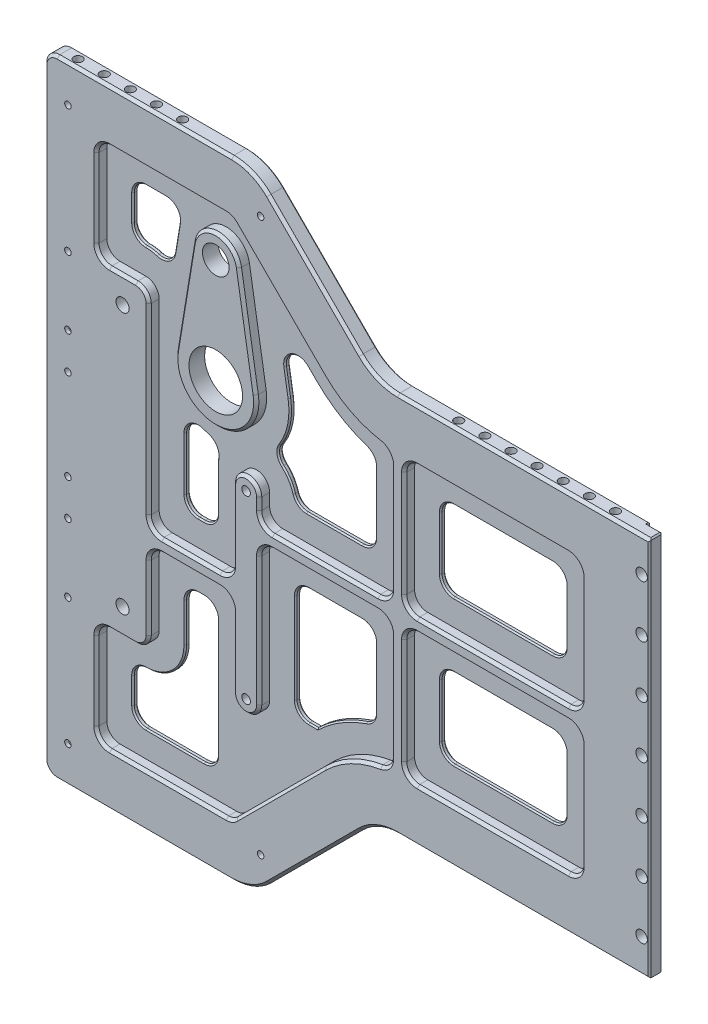
from build123d import *

# Parameters (mm, degrees)
EXTRUDE_1_DEPTH             = 5.999999995
CUT_EXTRUDE_1_DEPTH         = 306.838828368
CUT_EXTRUDE_1_DEPTH_BACK    = 306.838828368
SKETCH_3_W                  = 6
SKETCH_3_H                  = 0.999999998
CHAMFER_1_SIZE              = 1
M22X1_5_1_D                 = 20.5
HOLE_WIZARD_M12_1_D         = 10.2
HOLE_WIZARD_M4_1_D          = 3.3
CUT_EXTRUDE_2_DEPTH         = 4
FILLET_1_R                  = 5
SKETCH_14_W                 = 20
SKETCH_14_H                 = 120
EXTRUDE_2_DEPTH             = 4
FILLET_2_R                  = 5
SKETCH_15_W                 = 123.39
SKETCH_15_H                 = 5
SKETCH_15_W_2               = 32.285860782
EXTRUDE_3_DEPTH             = 4
FILLET_3_R                  = 5
EXTRUDE_START               = -5
EXTRUDE_4_DEPTH             = 5
FILLET_4_R                  = 5
CHAMFER_2_SIZE              = 1
CHAMFER_3_SIZE              = 1
SKETCH_17_W                 = 47.891589535
SKETCH_17_H                 = 30.5
CUT_EXTRUDE_3_DEPTH         = 4
FILLET_5_R                  = 5
CHAMFER_4_SIZE              = 0.5
HOLE_WIZARD_M6_1_D          = 5
HOLE_WIZARD_M3_1_D          = 2.5
HOLE_WIZARD_M3_1_DEPTH      = 7.5
HOLE_WIZARD_M3_1_TIP        = 0.751075774
HOLE_WIZARD_M4_2_AT_2_COUNT = 2
HOLE_WIZARD_M4_2_AT_2_PITCH = 10
HOLE_WIZARD_M4_2_AT_3_COUNT = 2
HOLE_WIZARD_M4_2_AT_3_PITCH = 20
HOLE_WIZARD_M4_2_AT_4_COUNT = 2
HOLE_WIZARD_M4_2_AT_4_PITCH = 30
HOLE_WIZARD_M4_2_AT_5_COUNT = 2
HOLE_WIZARD_M4_2_AT_5_PITCH = 40
HOLE_WIZARD_M4_2_AT_6_COUNT = 2
HOLE_WIZARD_M4_2_AT_6_PITCH = 50
HOLE_WIZARD_M4_2_AT_7_COUNT = 2
HOLE_WIZARD_M4_2_AT_7_PITCH = 60
HOLE_WIZARD_M4_3_AT_2_COUNT = 2
HOLE_WIZARD_M4_3_AT_2_PITCH = 10
HOLE_WIZARD_M4_3_AT_3_COUNT = 2
HOLE_WIZARD_M4_3_AT_3_PITCH = 20
HOLE_WIZARD_M4_3_AT_4_COUNT = 2
HOLE_WIZARD_M4_3_AT_4_PITCH = 30
HOLE_WIZARD_M4_3_AT_5_COUNT = 2
HOLE_WIZARD_M4_3_AT_5_PITCH = 40
HOLE_WIZARD_M4_4_AT_2_COUNT = 2
HOLE_WIZARD_M4_4_AT_2_PITCH = 7.5
CUT_EXTRUDE_4_DEPTH         = 338.473538273
CUT_EXTRUDE_4_DEPTH_BACK    = 338.473538273
SKETCH_32_R                 = 2.2
PATTERN_LINEAR_1_COUNT      = 7
PATTERN_LINEAR_1_PITCH      = 10
CHAMFER_5_SIZE              = 0.5


with BuildPart() as part:
    # 草图2 → 凸台-拉伸1 (new body)
    with BuildSketch(Plane.XY):
        with BuildLine():
            Line((-5.5, 47), (-5.5, 193))
            Line((-5.5, 193), (-101.891589535, 193))
            ThreePointArc((-101.891589535, 193), (-109.545258182, 194.52240935), (-116.033725159, 198.857864377))
            Line((-116.033725159, 198.857864377), (-151.317996406, 234.142135624))
            ThreePointArc((-151.317996406, 234.142135624), (-157.806463382, 238.477590651), (-165.46013203, 240))
            Line((-165.46013203, 240), (-232.175860782, 240))
            ThreePointArc((-232.175860782, 240), (-235.711394688, 238.535533906), (-237.175860782, 235))
            Line((-237.175860782, 235), (-237.175860782, 5))
            ThreePointArc((-237.175860782, 5), (-235.711394688, 1.464466094), (-232.175860782, 0))
            Line((-232.175860782, 0), (-165.46013203, 0))
            ThreePointArc((-165.46013203, 0), (-157.806463382, 1.52240935), (-151.317996406, 5.857864377))
            Line((-151.317996406, 5.857864377), (-116.033725158, 41.142135624))
            ThreePointArc((-116.033725158, 41.142135624), (-109.545258182, 45.477590651), (-101.891589535, 47))
            Line((-101.891589535, 47), (-5.5, 47))
        make_face()
    extrude(amount=-EXTRUDE_1_DEPTH)

    # 草图3 → 切除-拉伸1 (cut, two sides: drawn at the far end of the back side and taken through both)
    with BuildSketch(Plane.XZ.offset(-47).offset(-CUT_EXTRUDE_1_DEPTH_BACK)):
        with Locations((-8.5, -5.499999999)):
            Rectangle(SKETCH_3_W, SKETCH_3_H)
    extrude(amount=CUT_EXTRUDE_1_DEPTH + CUT_EXTRUDE_1_DEPTH_BACK, mode=Mode.SUBTRACT)

    # 倒角1
    chamfer_1_edges = [part.edges().sort_by_distance(p)[0] for p in [
        (-109.545258182, 45.477590651, 0),
        (-133.675860782, 23.5, 0),
        (-157.806463382, 1.52240935, 0),
        (-198.817996406, 0, 0),
        (-235.711394688, 1.464466094, 0),
        (-237.175860782, 120, 0),
        (-235.711394688, 238.535533906, 0),
        (-198.817996406, 240, 0),
        (-157.806463382, 238.477590651, 0),
        (-133.675860782, 216.5, 0),
        (-109.545258182, 194.52240935, 0),
        (-53.695794768, 193, 0),
        (-53.695794767, 47, 0),
    ]]
    chamfer(chamfer_1_edges, length=CHAMFER_1_SIZE)

    # M22x1.5 螺纹孔1 (through all)
    with Locations(Plane.XY):
        with Locations((-171.5, 162.75)):
            Hole(M22X1_5_1_D / 2)

    # M12 螺纹孔1 (through all)
    with Locations(Plane.XY):
        with Locations((-171.5, 202.75)):
            Hole(HOLE_WIZARD_M12_1_D / 2)

    # M4 螺纹孔1 (through all)
    with Locations(Plane.XY):
        with Locations((-159.89, 63), (-159.89, 132)):
            Hole(HOLE_WIZARD_M4_1_D / 2)

    # 草图13 → 切除-拉伸2 (cut)
    with BuildSketch(Plane.XY):
        with BuildLine():
            Line((-31.5, 173), (-101.891589535, 173))
            ThreePointArc((-101.891589535, 173), (-117.198926829, 176.0448187), (-130.175860782, 184.715728753))
            Line((-130.175860782, 184.715728753), (-165.46013203, 220))
            Line((-165.46013203, 220), (-217.175860782, 220))
            Line((-217.175860782, 220), (-217.175860782, 20))
            Line((-217.175860782, 20), (-165.46013203, 20))
            Line((-165.46013203, 20), (-130.175860782, 55.284271248))
            ThreePointArc((-130.175860782, 55.284271248), (-117.198926829, 63.955181301), (-101.891589535, 67))
            Line((-101.891589535, 67), (-31.5, 67))
            Line((-31.5, 67), (-31.5, 173))
        make_face()
        with BuildLine():
            Line((-180.380376893, 204.2125), (-186.793982426, 165.26875))
            ThreePointArc((-186.793982426, 165.26875), (-171.5, 147.25), (-156.206017575, 165.26875))
            Line((-156.206017575, 165.26875), (-162.619623108, 204.2125))
            ThreePointArc((-162.619623108, 204.2125), (-171.5, 211.75), (-180.380376893, 204.2125))
        make_face(mode=Mode.SUBTRACT)
        with BuildLine():
            Line((-164.89, 132), (-164.89, 63))
            ThreePointArc((-164.89, 63), (-159.89, 58), (-154.89, 63))
            Line((-154.89, 63), (-154.89, 132))
            ThreePointArc((-154.89, 132), (-159.89, 137), (-164.89, 132))
        make_face(mode=Mode.SUBTRACT)
    extrude(amount=-CUT_EXTRUDE_2_DEPTH, mode=Mode.SUBTRACT)

    # 圆角1
    fillet_1_edges = [part.edges().sort_by_distance(p)[0] for p in [
        (-31.5, 173, -2),
        (-31.5, 67, -2),
        (-165.46013203, 20, -2),
        (-217.175860782, 20, -2),
        (-217.175860782, 220, -2),
        (-165.46013203, 220, -2),
    ]]
    fillet(fillet_1_edges, radius=FILLET_1_R)

    # 草图14 → 凸台-拉伸2 (add)
    with BuildSketch(Plane.XY.offset(-4)):
        with Locations((-207.175860782, 120)):
            Rectangle(SKETCH_14_W, SKETCH_14_H)
    extrude(amount=EXTRUDE_2_DEPTH)

    # 圆角2
    fillet_2_edges = [part.edges().sort_by_distance(p)[0] for p in [
        (-197.175860782, 60, -2),
        (-197.175860782, 180, -2),
        (-217.175860782, 180, -2),
        (-217.175860782, 60, -2),
    ]]
    fillet(fillet_2_edges, radius=FILLET_2_R)

    # 草图15 → 凸台-拉伸3 (add)
    with BuildSketch(Plane.XY):
        with Locations((-93.195, 120)):
            Rectangle(SKETCH_15_W, SKETCH_15_H)
        with Locations((-181.032930391, 97.5)):
            Rectangle(SKETCH_15_W_2, SKETCH_15_H)
    extrude(amount=-EXTRUDE_3_DEPTH)

    # 圆角3
    fillet_3_edges = [part.edges().sort_by_distance(p)[0] for p in [
        (-31.5, 122.5, -2),
        (-31.5, 117.5, -2),
        (-154.89, 117.5, -2),
        (-154.89, 122.5, -2),
        (-164.89, 100, -2),
        (-164.89, 95, -2),
        (-197.175860782, 95, -2),
        (-197.175860782, 100, -2),
    ]]
    fillet(fillet_3_edges, radius=FILLET_3_R)

    # 凸台-拉伸4: read off the stored shape, not the designer's step
    # 凸台-拉伸4 outline → 凸台-拉伸4 (add)
    with BuildSketch(Plane.XY.offset(EXTRUDE_START)):
        with BuildLine():
            ThreePointArc((-101.891589535, 173), (-103.142200932, 173.019555141), (-104.391589535, 173.078201443))
            Line((-104.391589535, 173.078201443), (-104.391589535, 122.5))
            Line((-104.391589535, 122.5), (-99.391589535, 122.5))
            Line((-99.391589535, 122.5), (-99.391589535, 173))
            Line((-99.391589535, 173), (-101.891589535, 173))
        make_face()
        with BuildLine():
            Line((-99.391589535, 117.5), (-104.391589535, 117.5))
            Line((-104.391589535, 117.5), (-104.391589535, 66.921798557))
            ThreePointArc((-104.391589535, 66.921798557), (-103.142200932, 66.980444859), (-101.891589535, 67))
            Line((-101.891589535, 67), (-99.391589535, 67))
            Line((-99.391589535, 67), (-99.391589535, 117.5))
        make_face()
    extrude(amount=EXTRUDE_4_DEPTH)

    # 圆角4
    fillet_4_edges = [part.edges().sort_by_distance(p)[0] for p in [
        (-99.391589535, 122.5, -2),
        (-104.391589535, 122.5, -2),
        (-104.391589535, 173.078201443, -2),
        (-99.391589535, 173, -2),
        (-104.391589535, 117.5, -2),
        (-99.391589535, 117.5, -2),
        (-99.391589535, 67, -2),
        (-104.391589535, 66.921798557, -2),
    ]]
    fillet(fillet_4_edges, radius=FILLET_4_R)

    # 倒角2
    chamfer_2_edges = [part.edges().sort_by_distance(p)[0] for p in [
        (-147.085763359, 201.62563133, 0),
        (-120.235731737, 62.545638929, 0),
        (-159.89, 137, 0),
        (-154.89, 87.75, 0),
        (-159.89, 58, 0),
        (-164.89, 118.5, 0),
        (-65.445794768, 173, 0),
        (-31.5, 92.25, 0),
        (-147.085763359, 38.374368671, 0),
        (-189.853530312, 20, 0),
        (-217.175860782, 200, 0),
        (-189.853530312, 220, 0),
        (-32.964466094, 171.535533906, 0),
        (-32.964466094, 68.464466094, 0),
        (-165.61778268, 20.380602338, 0),
        (-215.711394688, 218.535533906, 0),
        (-165.61778268, 219.619397663, 0),
        (-215.711394688, 21.464466094, 0),
        (-197.175860782, 77.5, 0),
        (-207.175860782, 60, 0),
        (-217.175860782, 40, 0),
        (-207.175860782, 180, 0),
        (-198.640326876, 178.535533906, 0),
        (-198.640326876, 61.464466094, 0),
        (-215.711394688, 181.464466094, 0),
        (-215.711394688, 58.535533906, 0),
        (-129.640794768, 117.5, 0),
        (-181.032930391, 95, 0),
        (-164.89, 76.5, 0),
        (-181.032930391, 100, 0),
        (-197.175860782, 140, 0),
        (-65.445794768, 122.5, 0),
        (-154.89, 129.75, 0),
        (-31.5, 147.75, 0),
        (-153.425533906, 116.035533906, 0),
        (-166.354466094, 93.535533906, 0),
        (-195.711394688, 93.535533906, 0),
        (-32.964466094, 116.035533906, 0),
        (-195.711394688, 101.464466094, 0),
        (-153.425533906, 123.964466095, 0),
        (-166.354466094, 101.464466094, 0),
        (-32.964466094, 123.964466095, 0),
        (-104.391589535, 148.064700814, 0),
        (-129.640794768, 122.5, 0),
        (-104.391589535, 91.935299187, 0),
        (-99.391589535, 147.75, 0),
        (-99.391589535, 92.25, 0),
        (-65.445794768, 117.5, 0),
        (-120.235731737, 177.454361072, 0),
        (-65.445794768, 67, 0),
        (-105.856055629, 123.964466095, 0),
        (-105.856055629, 116.035533906, 0),
        (-97.927123441, 123.964466095, 0),
        (-97.927123441, 116.035533906, 0),
        (-97.927123441, 171.535533906, 0),
        (-105.572776456, 171.856887749, 0),
        (-97.927123441, 68.464466094, 0),
        (-105.572776456, 68.143112252, 0),
    ]]
    chamfer(chamfer_2_edges, length=CHAMFER_2_SIZE)

    # 倒角3
    chamfer_3_edges = [part.edges().sort_by_distance(p)[0] for p in [
        (-171.5, 211.75, 0),
        (-159.412820341, 184.740625, 0),
        (-171.5, 147.25, 0),
        (-183.587179659, 184.740625, 0),
    ]]
    chamfer(chamfer_3_edges, length=CHAMFER_3_SIZE)

    # 草图17 → 切除-拉伸3 (cut)
    with BuildSketch(Plane.XY.offset(-4)):
        with BuildLine():
            ThreePointArc((-189.260753785, 205.675), (-188.754109212, 207.877934798), (-187.975360391, 210))
            Line((-187.975360391, 210), (-207.175860782, 210))
            Line((-207.175860782, 210), (-207.175860782, 190))
            Line((-207.175860782, 190), (-202.175860782, 190))
            ThreePointArc((-202.175860782, 190), (-196.98409978, 189.072868141), (-192.434131716, 186.40608236))
            Line((-192.434131716, 186.40608236), (-189.260753785, 205.675))
        make_face()
        with BuildLine():
            ThreePointArc((-174.89, 132), (-174.535447054, 135.242048826), (-173.488549255, 138.330833923))
            ThreePointArc((-173.488549255, 138.330833923), (-180.763982021, 140.068980685), (-187.175860782, 143.921367847))
            Line((-187.175860782, 143.921367847), (-187.175860782, 110))
            Line((-187.175860782, 110), (-174.89, 110))
            Line((-174.89, 110), (-174.89, 132))
        make_face()
        with BuildLine():
            ThreePointArc((-114.391589535, 164.587708173), (-126.693895335, 169.585191156), (-137.246928594, 177.644660941))
            Line((-137.246928594, 177.644660941), (-151.464423298, 191.862155645))
            Line((-151.464423298, 191.862155645), (-147.325640682, 166.73125))
            ThreePointArc((-147.325640682, 166.73125), (-148.109839565, 155.459568271), (-153.868837287, 145.738471515))
            ThreePointArc((-153.868837287, 145.738471515), (-147.47231071, 140.414332575), (-144.89833565, 132.5))
            Line((-144.89833565, 132.5), (-114.391589535, 132.5))
            Line((-114.391589535, 132.5), (-114.391589535, 164.587708173))
        make_face()
        with BuildLine():
            Line((-144.89, 107.5), (-144.89, 63))
            Line((-144.89, 63), (-136.59029268, 63))
            ThreePointArc((-136.590292681, 63), (-126.293344426, 70.641200239), (-114.391589535, 75.412291828))
            Line((-114.391589535, 75.412291828), (-114.391589535, 107.5))
            Line((-114.391589535, 107.5), (-144.89, 107.5))
        make_face()
        with BuildLine():
            Line((-202.175860782, 50), (-207.175860782, 50))
            Line((-207.175860782, 50), (-207.175860782, 30))
            Line((-207.175860782, 30), (-174.89, 30))
            Line((-174.89, 30), (-174.89, 63))
            Line((-174.89, 63), (-174.89, 85))
            Line((-174.89, 85), (-187.175860782, 85))
            Line((-187.175860782, 85), (-187.175860782, 65))
            ThreePointArc((-187.175860782, 65), (-191.569259064, 54.393398282), (-202.175860782, 50))
        make_face()
        with Locations((-65.445794768, 92.25)):
            Rectangle(SKETCH_17_W, SKETCH_17_H)
        with Locations((-65.445794768, 147.75)):
            Rectangle(SKETCH_17_W, SKETCH_17_H)
    extrude(amount=-CUT_EXTRUDE_3_DEPTH, mode=Mode.SUBTRACT)

    # 圆角5
    fillet_5_edges = [part.edges().sort_by_distance(p)[0] for p in [
        (-187.175860782, 85, -4.999999997),
        (-174.89, 85, -4.999999997),
        (-153.868837287, 145.738471515, -4.999999997),
        (-173.488549255, 138.330833923, -4.999999997),
        (-114.391589535, 132.5, -4.999999997),
        (-144.89833565, 132.5, -4.999999997),
        (-192.434131716, 186.40608236, -4.999999997),
        (-174.89, 110, -4.999999997),
        (-187.175860782, 110, -4.999999997),
        (-187.175860782, 143.921367847, -4.999999997),
        (-144.89, 63, -4.999999997),
        (-144.89, 107.5, -4.999999997),
        (-114.391589535, 107.5, -4.999999997),
        (-89.391589535, 107.5, -4.999999997),
        (-89.391589535, 132.5, -4.999999997),
        (-41.5, 132.5, -4.999999997),
        (-41.5, 107.5, -4.999999997),
        (-89.391589535, 163, -4.999999997),
        (-41.5, 163, -4.999999997),
        (-41.5, 77, -4.999999997),
        (-89.391589535, 77, -4.999999997),
        (-114.391589535, 75.412291828, -4.999999997),
        (-114.391589535, 164.587708173, -4.999999997),
        (-151.464423298, 191.862155645, -4.999999997),
        (-187.975360391, 210, -4.999999997),
        (-207.175860782, 210, -4.999999997),
        (-207.175860782, 190, -4.999999997),
        (-174.89, 30, -4.999999997),
        (-207.175860782, 30, -4.999999997),
        (-207.175860782, 50, -4.999999997),
    ]]
    fillet(fillet_5_edges, radius=FILLET_5_R - 0.0001)  # a hair under: the kernel refuses the full size

    # 倒角4
    chamfer_4_edges = [part.edges().sort_by_distance(p)[0] for p in [
        (-187.175860782, 72.50005, -4),
        (-187.175860782, 72.50005, -5.999999995),
        (-181.032930391, 85, -4),
        (-181.032930391, 85, -5.999999995),
        (-174.89, 57.5, -5.999999995),
        (-174.89, 57.5, -4),
        (-147.189792596, 139.981524408, -5.999999995),
        (-147.189792596, 139.981524408, -4),
        (-147.494160374, 157.854117664, -5.999999995),
        (-147.494160374, 157.854117664, -4),
        (-114.391589535, 149.179168942, -4),
        (-114.391589535, 149.179168942, -5.999999995),
        (-130.02634021, 132.5, -4),
        (-130.02634021, 132.5, -5.999999995),
        (-190.403511183, 198.736116995, -5.999999995),
        (-190.403511183, 198.736116995, -4),
        (-199.922359725, 189.829758359, -5.999999995),
        (-199.922359725, 189.829758359, -4),
        (-174.89, 123.49995, -4),
        (-174.89, 123.49995, -5.999999995),
        (-181.032930391, 110, -4),
        (-181.032930391, 110, -5.999999995),
        (-187.175860782, 125.124786715, -4),
        (-187.175860782, 125.124786715, -5.999999995),
        (-179.363393998, 139.546184907, -5.999999995),
        (-179.363393998, 139.546184907, -4),
        (-174.86230757, 132.911046668, -5.999999995),
        (-174.86230757, 132.911046668, -4),
        (-138.24019634, 63, -4),
        (-138.24019634, 63, -5.999999995),
        (-144.89, 85.25, -4),
        (-144.89, 85.25, -5.999999995),
        (-129.640794768, 107.5, -4),
        (-129.640794768, 107.5, -5.999999995),
        (-114.391589535, 90.820831059, -4),
        (-114.391589535, 90.820831059, -5.999999995),
        (-89.391589535, 92.25, -4),
        (-89.391589535, 92.25, -5.999999995),
        (-65.445794768, 107.5, -4),
        (-65.445794768, 107.5, -5.999999995),
        (-65.445794768, 132.5, -4),
        (-65.445794768, 132.5, -5.999999995),
        (-89.391589535, 147.75, -4),
        (-89.391589535, 147.75, -5.999999995),
        (-41.5, 147.75, -4),
        (-41.5, 147.75, -5.999999995),
        (-41.5, 92.25, -4),
        (-41.5, 92.25, -5.999999995),
        (-65.445794768, 163, -4),
        (-65.445794768, 163, -5.999999995),
        (-65.445794768, 77, -4),
        (-65.445794768, 77, -5.999999995),
        (-127.829673943, 69.745944571, -5.999999995),
        (-127.829673943, 69.745944571, -4),
        (-198.307557146, 210, -4),
        (-198.307557146, 210, -5.999999995),
        (-207.175860782, 200, -4),
        (-207.175860782, 200, -5.999999995),
        (-191.032930391, 30, -4),
        (-191.032930391, 30, -5.999999995),
        (-207.175860782, 40, -4),
        (-207.175860782, 40, -5.999999995),
        (-185.711423977, 83.535563195, -4),
        (-185.711423977, 83.535563195, -5.999999995),
        (-176.354436805, 83.535563195, -4),
        (-176.354436805, 83.535563195, -5.999999995),
        (-151.545831458, 146.247727068, -4),
        (-151.545831458, 146.247727068, -5.999999995),
        (-115.85602634, 133.964436805, -4),
        (-115.85602634, 133.964436805, -5.999999995),
        (-143.671536847, 133.507805663, -4),
        (-143.671536847, 133.507805663, -5.999999995),
        (-193.608674211, 189.842375946, -4),
        (-193.608674211, 189.842375946, -5.999999995),
        (-176.354436805, 111.464436805, -4),
        (-176.354436805, 111.464436805, -5.999999995),
        (-185.711423977, 111.464436805, -4),
        (-185.711423977, 111.464436805, -5.999999995),
        (-185.000133833, 139.375572919, -4),
        (-185.000133833, 139.375572919, -5.999999995),
        (-175.568459377, 137.177720234, -4),
        (-175.568459377, 137.177720234, -5.999999995),
        (-143.425563196, 64.464436805, -4),
        (-143.425563196, 64.464436805, -5.999999995),
        (-143.425563196, 106.035563196, -4),
        (-143.425563196, 106.035563196, -5.999999995),
        (-115.85602634, 106.035563196, -4),
        (-115.85602634, 106.035563196, -5.999999995),
        (-87.92715273, 106.035563196, -4),
        (-87.92715273, 106.035563196, -5.999999995),
        (-87.92715273, 133.964436805, -4),
        (-87.92715273, 133.964436805, -5.999999995),
        (-42.964436805, 133.964436805, -4),
        (-42.964436805, 133.964436805, -5.999999995),
        (-42.964436805, 106.035563196, -4),
        (-42.964436805, 106.035563196, -5.999999995),
        (-87.92715273, 161.535563196, -4),
        (-87.92715273, 161.535563196, -5.999999995),
        (-42.964436805, 161.535563196, -4),
        (-42.964436805, 161.535563196, -5.999999995),
        (-42.964436805, 78.464436805, -4),
        (-42.964436805, 78.464436805, -5.999999995),
        (-87.92715273, 78.464436805, -4),
        (-87.92715273, 78.464436805, -5.999999995),
        (-115.332351923, 76.22224681, -4),
        (-115.332351923, 76.22224681, -5.999999995),
        (-115.332351923, 163.777753191, -4),
        (-115.332351923, 163.777753191, -5.999999995),
        (-146.287605487, 181.77877827, -4),
        (-146.287605487, 181.77877827, -5.999999995),
        (-190.627242078, 208.235580066, -4),
        (-190.627242078, 208.235580066, -5.999999995),
        (-205.711423977, 208.535563196, -4),
        (-205.711423977, 208.535563196, -5.999999995),
        (-205.711423977, 191.464436805, -4),
        (-205.711423977, 191.464436805, -5.999999995),
        (-176.354436805, 31.464436805, -4),
        (-176.354436805, 31.464436805, -5.999999995),
        (-205.711423977, 31.464436805, -4),
        (-205.711423977, 31.464436805, -5.999999995),
        (-205.711423977, 48.535563195, -4),
        (-205.711423977, 48.535563195, -5.999999995),
        (-128.22192171, 170.494546144, -5.999999995),
        (-138.857744276, 179.255476623, -5.999999995),
        (-148.131553941, 171.624797679, -5.999999995),
        (-191.569259064, 54.393398282, -5.999999995),
        (-191.569259064, 54.393398282, -4),
        (-148.131553941, 171.624797679, -4),
        (-128.22192171, 170.494546144, -4),
        (-138.857744276, 179.255476623, -4),
    ]]
    chamfer(chamfer_4_edges, length=CHAMFER_4_SIZE)

    # M6 螺纹孔1 (through all)
    with Locations(Plane.XY):
        with Locations((-207.175860782, 170), (-207.175860782, 70)):
            Hole(HOLE_WIZARD_M6_1_D / 2)

    # M3 螺纹孔1
    with Locations(Plane.XY):
        with Locations((-154.33, 225.830634294), (-228.08, 225.840634294), (-228.08, 177.320634294), (-228.08, 151.210634294), (-228.08, 137.320634294), (-228.08, 102.679365706), (-228.08, 88.789365706), (-228.08, 62.679365706), (-228.08, 14.159365706), (-154.33, 14.169365706)):
            Hole(HOLE_WIZARD_M3_1_D / 2, depth=HOLE_WIZARD_M3_1_DEPTH)
            with Locations((0, 0, -(HOLE_WIZARD_M3_1_DEPTH + HOLE_WIZARD_M3_1_TIP / 2))):  # 118° drill point
                Cone(0, HOLE_WIZARD_M3_1_D / 2, HOLE_WIZARD_M3_1_TIP, mode=Mode.SUBTRACT)

    # 草图26 → M4 螺纹孔2 (revolve, cut)
    with BuildSketch(Plane(origin=(-81.5, 47, -3), x_dir=(0, 0, -1), z_dir=(1, 0, 0))):
        Polygon((0, 0), (0, 11.091420021), (1.65, 10.1), (1.65, 0), align=None)
    hole_wizard_m4_2 = revolve(axis=Axis((-81.5, 40.65, -3), (0, 1, 0)), mode=Mode.SUBTRACT)

    # M4 螺纹孔2 at 2: M4 螺纹孔2 ×2
    with Locations(*[(i * HOLE_WIZARD_M4_2_AT_2_PITCH, 0, 0) for i in range(1, HOLE_WIZARD_M4_2_AT_2_COUNT)]):
        add(hole_wizard_m4_2, mode=Mode.SUBTRACT)

    # M4 螺纹孔2 at 3: M4 螺纹孔2 ×2
    with Locations(*[(i * HOLE_WIZARD_M4_2_AT_3_PITCH, 0, 0) for i in range(1, HOLE_WIZARD_M4_2_AT_3_COUNT)]):
        add(hole_wizard_m4_2, mode=Mode.SUBTRACT)

    # M4 螺纹孔2 at 4: M4 螺纹孔2 ×2
    with Locations(*[(i * HOLE_WIZARD_M4_2_AT_4_PITCH, 0, 0) for i in range(1, HOLE_WIZARD_M4_2_AT_4_COUNT)]):
        add(hole_wizard_m4_2, mode=Mode.SUBTRACT)

    # M4 螺纹孔2 at 5: M4 螺纹孔2 ×2
    with Locations(*[(i * HOLE_WIZARD_M4_2_AT_5_PITCH, 0, 0) for i in range(1, HOLE_WIZARD_M4_2_AT_5_COUNT)]):
        add(hole_wizard_m4_2, mode=Mode.SUBTRACT)

    # M4 螺纹孔2 at 6: M4 螺纹孔2 ×2
    with Locations(*[(i * HOLE_WIZARD_M4_2_AT_6_PITCH, 0, 0) for i in range(1, HOLE_WIZARD_M4_2_AT_6_COUNT)]):
        add(hole_wizard_m4_2, mode=Mode.SUBTRACT)

    # M4 螺纹孔2 at 7: M4 螺纹孔2 ×2
    with Locations(*[(i * HOLE_WIZARD_M4_2_AT_7_PITCH, 0, 0) for i in range(1, HOLE_WIZARD_M4_2_AT_7_COUNT)]):
        add(hole_wizard_m4_2, mode=Mode.SUBTRACT)

    # 草图28 → M4 螺纹孔3 (revolve, cut)
    with BuildSketch(Plane(origin=(-187.175860782, 0, -3), x_dir=(0, 0, -1), z_dir=(1, 0, 0))):
        Polygon((0, 0), (0, 11.091420021), (1.65, 10.1), (1.65, 0), align=None)
    hole_wizard_m4_3 = revolve(axis=Axis((-187.175860782, -6.35, -3), (0, 1, 0)), mode=Mode.SUBTRACT)

    # M4 螺纹孔3 at 2: M4 螺纹孔3 ×2
    with Locations(*[(-i * HOLE_WIZARD_M4_3_AT_2_PITCH, 0, 0) for i in range(1, HOLE_WIZARD_M4_3_AT_2_COUNT)]):
        add(hole_wizard_m4_3, mode=Mode.SUBTRACT)

    # M4 螺纹孔3 at 3: M4 螺纹孔3 ×2
    with Locations(*[(-i * HOLE_WIZARD_M4_3_AT_3_PITCH, 0, 0) for i in range(1, HOLE_WIZARD_M4_3_AT_3_COUNT)]):
        add(hole_wizard_m4_3, mode=Mode.SUBTRACT)

    # M4 螺纹孔3 at 4: M4 螺纹孔3 ×2
    with Locations(*[(-i * HOLE_WIZARD_M4_3_AT_4_PITCH, 0, 0) for i in range(1, HOLE_WIZARD_M4_3_AT_4_COUNT)]):
        add(hole_wizard_m4_3, mode=Mode.SUBTRACT)

    # M4 螺纹孔3 at 5: M4 螺纹孔3 ×2
    with Locations(*[(-i * HOLE_WIZARD_M4_3_AT_5_PITCH, 0, 0) for i in range(1, HOLE_WIZARD_M4_3_AT_5_COUNT)]):
        add(hole_wizard_m4_3, mode=Mode.SUBTRACT)

    # 草图30 → M4 螺纹孔4 (revolve, cut)
    with BuildSketch(Plane(origin=(-237.175860782, 20.5, -3), x_dir=(0, 0, 1), z_dir=(0, 1, 0))):
        Polygon((0, 0), (0, 11.091420021), (1.65, 10.1), (1.65, 0), align=None)
    hole_wizard_m4_4 = revolve(axis=Axis((-243.525860782, 20.5, -3), (1, 0, 0)), mode=Mode.SUBTRACT)

    # M4 螺纹孔4 at 2: M4 螺纹孔4 ×2
    with Locations(*[(0, -i * HOLE_WIZARD_M4_4_AT_2_PITCH, 0) for i in range(1, HOLE_WIZARD_M4_4_AT_2_COUNT)]):
        add(hole_wizard_m4_4, mode=Mode.SUBTRACT)

    # 镜向1: M4 螺纹孔2, M4 螺纹孔3, M4 螺纹孔4 across plane
    add(hole_wizard_m4_2.mirror(Plane(origin=(0, 120, 0), x_dir=(0, 0, 1), z_dir=(0, -1, 0))), mode=Mode.SUBTRACT)
    add(hole_wizard_m4_3.mirror(Plane(origin=(0, 120, 0), x_dir=(0, 0, 1), z_dir=(0, -1, 0))), mode=Mode.SUBTRACT)
    add(hole_wizard_m4_4.mirror(Plane(origin=(0, 120, 0), x_dir=(0, 0, 1), z_dir=(0, -1, 0))), mode=Mode.SUBTRACT)

    # 镜向1 copy 1 sketch → 镜向1 copy 1 (revolve, cut)
    with BuildSketch(Plane(origin=(-71.5, 193, -3), x_dir=(0, 0, -1), z_dir=(1, 0, 0))):
        Polygon((0, 0), (0, -11.091420021), (1.65, -10.1), (1.65, 0), align=None)
    revolve(axis=Axis((-71.5, 199.35, -3), (0, 1, 0)), mode=Mode.SUBTRACT)

    # 镜向1 copy 2 sketch → 镜向1 copy 2 (revolve, cut)
    with BuildSketch(Plane(origin=(-61.5, 193, -3), x_dir=(0, 0, -1), z_dir=(1, 0, 0))):
        Polygon((0, 0), (0, -11.091420021), (1.65, -10.1), (1.65, 0), align=None)
    revolve(axis=Axis((-61.5, 199.35, -3), (0, 1, 0)), mode=Mode.SUBTRACT)

    # 镜向1 copy 3 sketch → 镜向1 copy 3 (revolve, cut)
    with BuildSketch(Plane(origin=(-51.5, 193, -3), x_dir=(0, 0, -1), z_dir=(1, 0, 0))):
        Polygon((0, 0), (0, -11.091420021), (1.65, -10.1), (1.65, 0), align=None)
    revolve(axis=Axis((-51.5, 199.35, -3), (0, 1, 0)), mode=Mode.SUBTRACT)

    # 镜向1 copy 4 sketch → 镜向1 copy 4 (revolve, cut)
    with BuildSketch(Plane(origin=(-41.5, 193, -3), x_dir=(0, 0, -1), z_dir=(1, 0, 0))):
        Polygon((0, 0), (0, -11.091420021), (1.65, -10.1), (1.65, 0), align=None)
    revolve(axis=Axis((-41.5, 199.35, -3), (0, 1, 0)), mode=Mode.SUBTRACT)

    # 镜向1 copy 5 sketch → 镜向1 copy 5 (revolve, cut)
    with BuildSketch(Plane(origin=(-31.5, 193, -3), x_dir=(0, 0, -1), z_dir=(1, 0, 0))):
        Polygon((0, 0), (0, -11.091420021), (1.65, -10.1), (1.65, 0), align=None)
    revolve(axis=Axis((-31.5, 199.35, -3), (0, 1, 0)), mode=Mode.SUBTRACT)

    # 镜向1 copy 6 sketch → 镜向1 copy 6 (revolve, cut)
    with BuildSketch(Plane(origin=(-21.5, 193, -3), x_dir=(0, 0, -1), z_dir=(1, 0, 0))):
        Polygon((0, 0), (0, -11.091420021), (1.65, -10.1), (1.65, 0), align=None)
    revolve(axis=Axis((-21.5, 199.35, -3), (0, 1, 0)), mode=Mode.SUBTRACT)

    # 镜向1 copy 7 sketch → 镜向1 copy 7 (revolve, cut)
    with BuildSketch(Plane(origin=(-197.175860782, 240.000000001, -3), x_dir=(0, 0, -1), z_dir=(1, 0, 0))):
        Polygon((0, 0), (0, -11.091420021), (1.65, -10.1), (1.65, 0), align=None)
    revolve(axis=Axis((-197.175860782, 246.350000001, -3), (0, 1, 0)), mode=Mode.SUBTRACT)

    # 镜向1 copy 8 sketch → 镜向1 copy 8 (revolve, cut)
    with BuildSketch(Plane(origin=(-207.175860782, 240.000000001, -3), x_dir=(0, 0, -1), z_dir=(1, 0, 0))):
        Polygon((0, 0), (0, -11.091420021), (1.65, -10.1), (1.65, 0), align=None)
    revolve(axis=Axis((-207.175860782, 246.350000001, -3), (0, 1, 0)), mode=Mode.SUBTRACT)

    # 镜向1 copy 9 sketch → 镜向1 copy 9 (revolve, cut)
    with BuildSketch(Plane(origin=(-217.175860782, 240.000000001, -3), x_dir=(0, 0, -1), z_dir=(1, 0, 0))):
        Polygon((0, 0), (0, -11.091420021), (1.65, -10.1), (1.65, 0), align=None)
    revolve(axis=Axis((-217.175860782, 246.350000001, -3), (0, 1, 0)), mode=Mode.SUBTRACT)

    # 镜向1 copy 10 sketch → 镜向1 copy 10 (revolve, cut)
    with BuildSketch(Plane(origin=(-227.175860782, 240.000000001, -3), x_dir=(0, 0, -1), z_dir=(1, 0, 0))):
        Polygon((0, 0), (0, -11.091420021), (1.65, -10.1), (1.65, 0), align=None)
    revolve(axis=Axis((-227.175860782, 246.350000001, -3), (0, 1, 0)), mode=Mode.SUBTRACT)

    # 镜向1 copy 11 sketch → 镜向1 copy 11 (revolve, cut)
    with BuildSketch(Plane(origin=(-237.175860782, 227.000000001, -3), x_dir=(0, 0, 1), z_dir=(0, -1, 0))):
        Polygon((0, 0), (0, -11.091420021), (1.65, -10.1), (1.65, 0), align=None)
    revolve(axis=Axis((-243.525860782, 227.000000001, -3), (-1, 0, 0)), mode=Mode.SUBTRACT)

    # 草图32 → 切除-拉伸4 (cut, two sides: drawn at the far end of the back side and taken through both)
    with BuildSketch(Plane.XY.offset(-CUT_EXTRUDE_4_DEPTH_BACK)):
        with Locations((-8.5, 180)):
            Circle(SKETCH_32_R)
        with Locations((-8.5, 160)):
            Circle(SKETCH_32_R)
        with Locations((-8.5, 140)):
            Circle(SKETCH_32_R)
        with Locations((-8.5, 120)):
            Circle(SKETCH_32_R)
        with Locations((-8.5, 100)):
            Circle(SKETCH_32_R)
        with Locations((-8.5, 80)):
            Circle(SKETCH_32_R)
        with Locations((-8.5, 60)):
            Circle(SKETCH_32_R)
    extrude(amount=CUT_EXTRUDE_4_DEPTH + CUT_EXTRUDE_4_DEPTH_BACK, mode=Mode.SUBTRACT)

    # 草图37 → M4 螺纹孔5 (revolve, cut)
    with BuildSketch(Plane(origin=(-237.175860782, 150, -3), x_dir=(0, 0, 1), z_dir=(0, 1, 0))):
        Polygon((0, 0), (0, 11.091420021), (1.65, 10.1), (1.65, 0), align=None)
    hole_wizard_m4_5 = revolve(axis=Axis((-243.525860782, 150, -3), (1, 0, 0)), mode=Mode.SUBTRACT)

    # 阵列(线性)1: M4 螺纹孔5 ×7
    with Locations(*[(0, -i * PATTERN_LINEAR_1_PITCH, 0) for i in range(1, PATTERN_LINEAR_1_COUNT)]):
        add(hole_wizard_m4_5, mode=Mode.SUBTRACT)

    # 倒角5
    chamfer_5_edges = [part.edges().sort_by_distance(p)[0] for p in [
        (-56.695794768, 193, -5.999999995),
        (-109.545258182, 194.52240935, -5.999999995),
        (-133.675860782, 216.5, -5.999999995),
        (-157.806463382, 238.477590651, -5.999999995),
        (-198.817996406, 240, -5.999999995),
        (-235.711394688, 238.535533906, -5.999999995),
        (-237.175860782, 120, -5.999999995),
        (-235.711394688, 1.464466094, -5.999999995),
        (-198.817996406, 0, -5.999999995),
        (-157.806463382, 1.52240935, -5.999999995),
        (-133.675860782, 23.5, -5.999999995),
        (-109.545258182, 45.477590651, -5.999999995),
        (-56.695794767, 47, -5.999999995),
        (-5.5, 193, -3),
        (-5.5, 47, -3),
        (-8.5, 47, -5),
        (-8.5, 193, -5),
        (-5.5, 120, -5),
        (-5.5, 120, 0),
    ]]
    chamfer(chamfer_5_edges, length=CHAMFER_5_SIZE - 0.0001)  # a hair under: the kernel refuses the full size


solid = part.part
